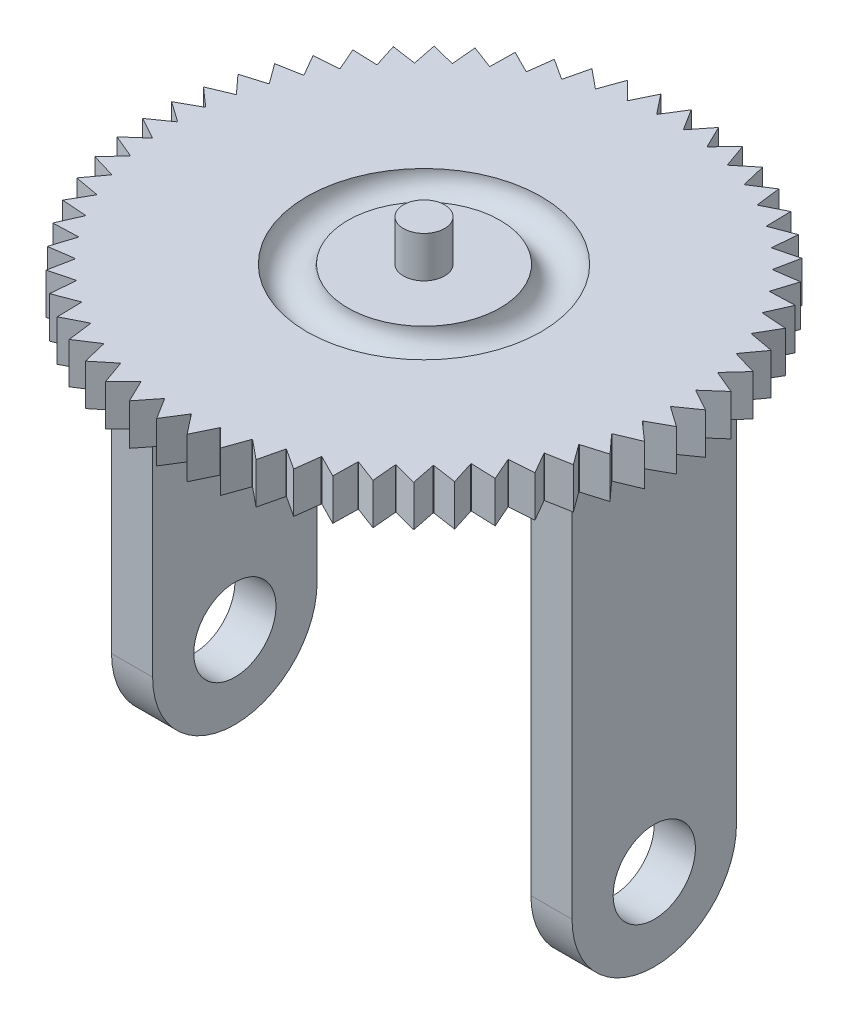
from build123d import *

# Parameters (mm, degrees)
SKETCH1_R           = 76.2
BOSS_EXTRUDE1_DEPTH = 12.7
SKETCH2_R           = 6.35
BOSS_EXTRUDE2_DEPTH = 12.7
SKETCH5_W           = 12.7
SKETCH5_H           = 50.8
BOSS_EXTRUDE3_DEPTH = 139.7
SKETCH6_R           = 12.7
CUT_EXTRUDE1_DEPTH  = 217.854127007
BOSS_EXTRUDE4_DEPTH = 12.7


with BuildPart() as part:
    # Sketch1 → Boss-Extrude1 (new body)
    with BuildSketch(Plane(origin=(0, 0, 0), x_dir=(1, 0, 0), z_dir=(0, 1, 0))):
        Circle(SKETCH1_R)
    extrude(amount=BOSS_EXTRUDE1_DEPTH)

    # Sketch2 → Boss-Extrude2 (add)
    with BuildSketch(Plane(origin=(0, 12.7, 0), x_dir=(1, 0, 0), z_dir=(0, 1, 0))):
        Circle(SKETCH2_R)
    extrude(amount=BOSS_EXTRUDE2_DEPTH)

    # Sketch4 → Cut-Revolve3 (revolve, cut)
    with BuildSketch(Plane.XY):
        with BuildLine():
            Line((-23.495, 12.7), (-36.195, 12.7))
            ThreePointArc((-36.195, 12.7), (-29.845, 6.35), (-23.495, 12.7))
        make_face()
    revolve(axis=Axis((0, 0, 0), (0, 1, 0)), mode=Mode.SUBTRACT)

    # Sketch5 → Boss-Extrude3 (add)
    with BuildSketch(Plane.XZ):
        with Locations((64.77, 0)):
            Rectangle(SKETCH5_W, SKETCH5_H)
        with Locations((-64.77, 0)):
            Rectangle(SKETCH5_W, SKETCH5_H)
    extrude(amount=BOSS_EXTRUDE3_DEPTH)

    # Sketch6 → Cut-Extrude1 (cut, through all)
    with BuildSketch(Plane.ZY.offset(71.12)):
        with BuildLine():
            ThreePointArc((7.5e-08, -139.7), (-17.960512216, -132.260512269), (-25.4, -114.3))
            Line((-25.4, -114.3), (-25.4, -139.7))
            Line((-25.4, -139.7), (7.5e-08, -139.7))
        make_face()
        with BuildLine():
            ThreePointArc((25.4, -114.3), (17.960512269, -132.260512216), (7.5e-08, -139.7))
            Line((7.5e-08, -139.7), (25.4, -139.7))
            Line((25.4, -139.7), (25.4, -114.3))
        make_face()
        with Locations((0, -114.3)):
            Circle(SKETCH6_R)
    extrude(amount=-CUT_EXTRUDE1_DEPTH, mode=Mode.SUBTRACT)

    # Sketch7 → Boss-Extrude4 (add)
    with BuildSketch(Plane(origin=(0, 12.7, 0), x_dir=(1, 0, 0), z_dir=(0, 1, 0))):
        Polygon((0, 82.55), (-4.045440703, 76.092538462), (4.045440703, 76.092538462), align=None)
        Polygon((4.205324412, 76.083869819), (12.248776724, 75.209091663), (8.925224971, 82.066088363), align=None)
        Polygon((12.406785943, 75.183187366), (20.308507037, 73.443887029), (17.745809839, 80.620026874), align=None)
        Polygon((20.462789252, 73.401050783), (28.130138673, 70.81761997), (26.358341313, 78.228769281), align=None)
        Polygon((28.278885067, 70.75835399), (35.621970154, 67.361081066), (34.661845334, 74.920350894), align=None)
        Polygon((35.763436809, 67.286080192), (42.696166603, 63.114795075), (42.55897091, 70.733559893), align=None)
        Polygon((42.828694954, 63.024938624), (49.269789537, 58.128545819), (49.957131464, 65.717482574), align=None)
        Polygon((49.39182581, 58.024887274), (55.265769236, 52.46079251), (56.769590328, 59.930927858), align=None)
        Polygon((55.375882667, 52.344547174), (60.613808321, 46.177984374), (62.916477651, 53.441737809), align=None)
        Polygon((60.71070793, 46.050515118), (65.251205923, 39.353781593), (68.325726798, 46.325992246), align=None)
        Polygon((65.333755652, 39.216582876), (69.123592795, 32.068191704), (72.933919269, 38.66711678), align=None)
        Polygon((69.190824823, 31.922872056), (72.185568742, 24.406631587), (76.687028221, 30.554904723), align=None)
        Polygon((72.236694836, 24.254894748), (74.401234895, 16.45892603), (79.541051883, 22.084464346), align=None)
        Polygon((74.435655648, 16.302550976), (75.744614595, 8.318254614), (81.462529436, 13.355103815), align=None)
        Polygon((75.761926454, 8.159074699), (76.199957943, 0.080059268), (82.428933313, 4.469166904), align=None)
        Polygon((76.199957943, -0.080059268), (75.761926454, -8.159074699), (82.428933313, -4.469166904), align=None)
        Polygon((75.744614595, -8.318254614), (74.435655648, -16.302550976), (81.462529436, -13.355103815), align=None)
        Polygon((74.401234895, -16.45892603), (72.236694836, -24.254894748), (79.541051883, -22.084464346), align=None)
        Polygon((72.185568742, -24.406631587), (69.190824823, -31.922872055), (76.687028221, -30.554904723), align=None)
        Polygon((69.123592795, -32.068191704), (65.333755652, -39.216582876), (72.933919269, -38.66711678), align=None)
        Polygon((65.251205923, -39.353781593), (60.71070793, -46.050515117), (68.325726798, -46.325992246), align=None)
        Polygon((60.613808321, -46.177984374), (55.375882667, -52.344547174), (62.916477651, -53.441737809), align=None)
        Polygon((55.265769236, -52.46079251), (49.39182581, -58.024887274), (56.769590328, -59.930927858), align=None)
        Polygon((49.269789537, -58.128545819), (42.828694955, -63.024938624), (49.957131464, -65.717482574), align=None)
        Polygon((42.696166603, -63.114795075), (35.763436809, -67.286080192), (42.55897091, -70.733559893), align=None)
        Polygon((35.621970154, -67.361081066), (28.278885067, -70.75835399), (34.661845334, -74.920350894), align=None)
        Polygon((28.130138674, -70.81761997), (20.462789252, -73.401050783), (26.358341313, -78.228769281), align=None)
        Polygon((20.308507037, -73.443887029), (12.406785943, -75.183187366), (17.74580984, -80.620026874), align=None)
        Polygon((12.248776724, -75.209091663), (4.205324412, -76.083869819), (8.925224971, -82.066088363), align=None)
        Polygon((4.045440703, -76.092538462), (-4.045440703, -76.092538462), (0, -82.55), align=None)
        Polygon((-4.205324412, -76.083869819), (-12.248776724, -75.209091663), (-8.925224971, -82.066088363), align=None)
        Polygon((-12.406785943, -75.183187366), (-20.308507037, -73.443887029), (-17.745809839, -80.620026874), align=None)
        Polygon((-20.462789252, -73.401050783), (-28.130138673, -70.81761997), (-26.358341313, -78.228769281), align=None)
        Polygon((-28.278885066, -70.75835399), (-35.621970153, -67.361081066), (-34.661845334, -74.920350894), align=None)
        Polygon((-35.763436809, -67.286080192), (-42.696166603, -63.114795075), (-42.55897091, -70.733559893), align=None)
        Polygon((-42.828694954, -63.024938624), (-49.269789537, -58.128545819), (-49.957131464, -65.717482574), align=None)
        Polygon((-49.39182581, -58.024887274), (-55.265769236, -52.46079251), (-56.769590328, -59.930927858), align=None)
        Polygon((-55.375882667, -52.344547174), (-60.61380832, -46.177984374), (-62.916477651, -53.441737809), align=None)
        Polygon((-60.71070793, -46.050515118), (-65.251205922, -39.353781593), (-68.325726798, -46.325992246), align=None)
        Polygon((-65.333755652, -39.216582876), (-69.123592795, -32.068191704), (-72.933919269, -38.66711678), align=None)
        Polygon((-69.190824823, -31.922872056), (-72.185568742, -24.406631587), (-76.687028221, -30.554904723), align=None)
        Polygon((-72.236694835, -24.254894748), (-74.401234895, -16.45892603), (-79.541051882, -22.084464346), align=None)
        Polygon((-74.435655647, -16.302550976), (-75.744614595, -8.318254614), (-81.462529436, -13.355103815), align=None)
        Polygon((-75.761926454, -8.159074699), (-76.199957943, -0.080059268), (-82.428933313, -4.469166904), align=None)
        Polygon((-76.199957943, 0.080059268), (-75.761926454, 8.159074699), (-82.428933313, 4.469166904), align=None)
        Polygon((-75.744614595, 8.318254614), (-74.435655647, 16.302550976), (-81.462529436, 13.355103815), align=None)
        Polygon((-74.401234895, 16.45892603), (-72.236694836, 24.254894748), (-79.541051882, 22.084464346), align=None)
        Polygon((-72.185568742, 24.406631587), (-69.190824823, 31.922872055), (-76.687028221, 30.554904723), align=None)
        Polygon((-69.123592795, 32.068191704), (-65.333755652, 39.216582876), (-72.933919269, 38.66711678), align=None)
        Polygon((-65.251205922, 39.353781593), (-60.71070793, 46.050515118), (-68.325726798, 46.325992246), align=None)
        Polygon((-60.613808321, 46.177984374), (-55.375882667, 52.344547174), (-62.916477651, 53.441737809), align=None)
        Polygon((-55.265769236, 52.46079251), (-49.39182581, 58.024887274), (-56.769590328, 59.930927858), align=None)
        Polygon((-49.269789537, 58.128545819), (-42.828694954, 63.024938624), (-49.957131464, 65.717482574), align=None)
        Polygon((-42.696166603, 63.114795075), (-35.763436809, 67.286080192), (-42.55897091, 70.733559893), align=None)
        Polygon((-35.621970154, 67.361081066), (-28.278885067, 70.75835399), (-34.661845334, 74.920350894), align=None)
        Polygon((-28.130138673, 70.81761997), (-20.462789252, 73.401050783), (-26.358341313, 78.228769281), align=None)
        Polygon((-20.308507037, 73.443887029), (-12.406785943, 75.183187366), (-17.745809839, 80.620026874), align=None)
        Polygon((-12.248776724, 75.209091663), (-4.205324412, 76.083869819), (-8.925224971, 82.066088363), align=None)
    extrude(amount=-BOSS_EXTRUDE4_DEPTH)


solid = part.part
